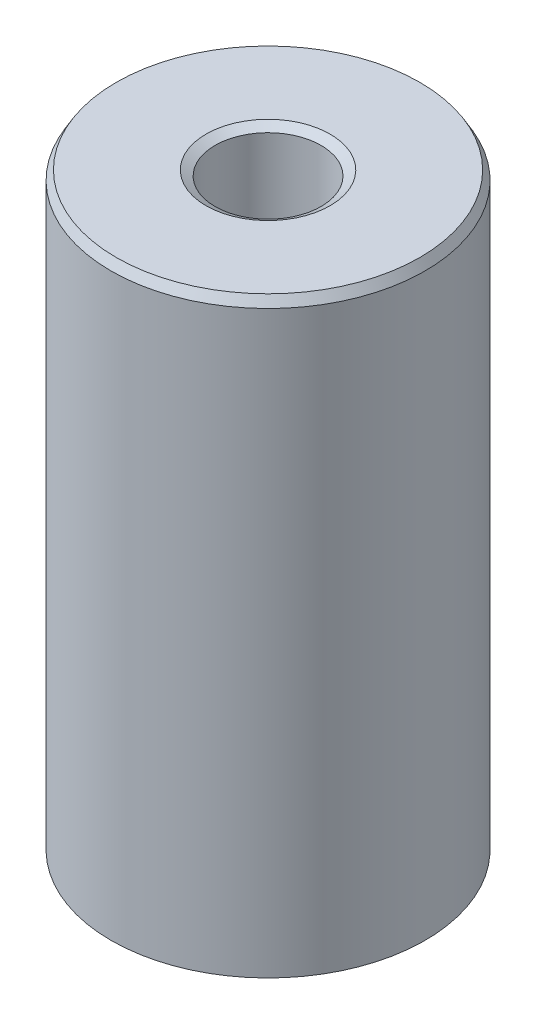
from build123d import *
from OCP.BRepFilletAPI import BRepFilletAPI_MakeChamfer

# Parameters (mm, degrees)
SKETCH1_R           = 10
BOSS_EXTRUDE1_DEPTH = 37.842107728
SKETCH2_R           = 3.376572091
CUT_EXTRUDE1_DEPTH  = 41.398330625
CHAMFER1_SIZE       = 0.575905897
CHAMFER1_SIZE2      = 0.332499425


with BuildPart() as part:
    # Sketch1 → Boss-Extrude1 (new body)
    with BuildSketch(Plane(origin=(0, 0, 0), x_dir=(1, 0, 0), z_dir=(0, 1, 0))):
        Circle(SKETCH1_R)
    extrude(amount=BOSS_EXTRUDE1_DEPTH)

    # Sketch2 → Cut-Extrude1 (cut, through all)
    with BuildSketch(Plane(origin=(0, 0, 0), x_dir=(1, 0, 0), z_dir=(0, 1, 0))):
        Circle(SKETCH2_R)
    extrude(amount=CUT_EXTRUDE1_DEPTH, mode=Mode.SUBTRACT)

    # Chamfer1: one chamfer whose edges measure the first distance from different faces: ONE call of the kernel's chamfer builder (chamfer() names one face for all edges)
    chamfer1_edges_1 = [part.edges().sort_by_distance(p)[0] for p in [
        (-3.376572091, 37.842107728, 0),
    ]]
    chamfer1_side_1 = [part.faces().sort_by_distance(p)[0] for p in [
        (-9.717157288, 37.842107728, 0),
    ]]
    chamfer1_edges_2 = [part.edges().sort_by_distance(p)[0] for p in [
        (-3.376572091, 0, 0),
    ]]
    chamfer1_side_2 = [part.faces().sort_by_distance(p)[0] for p in [
        (-3.376572091, 18.921053864, 0),
    ]]
    chamfer1_edges_3 = [part.edges().sort_by_distance(p)[0] for p in [
        (-10, 0, 0),
    ]]
    chamfer1_side_3 = [part.faces().sort_by_distance(p)[0] for p in [
        (-9.717157288, 0, 0),
    ]]
    chamfer1_edges_4 = [part.edges().sort_by_distance(p)[0] for p in [
        (-10, 37.842107728, 0),
    ]]
    chamfer1_side_4 = [part.faces().sort_by_distance(p)[0] for p in [
        (-10, 18.921053864, 0),
    ]]
    chamfer1 = BRepFilletAPI_MakeChamfer(part.part.solid().wrapped)
    for e in chamfer1_edges_1:
        chamfer1.Add(CHAMFER1_SIZE, CHAMFER1_SIZE2, e.wrapped, chamfer1_side_1[0].wrapped)  # the first distance lies on this face
    for e in chamfer1_edges_2:
        chamfer1.Add(CHAMFER1_SIZE, CHAMFER1_SIZE2, e.wrapped, chamfer1_side_2[0].wrapped)  # the first distance lies on this face
    for e in chamfer1_edges_3:
        chamfer1.Add(CHAMFER1_SIZE, CHAMFER1_SIZE2, e.wrapped, chamfer1_side_3[0].wrapped)  # the first distance lies on this face
    for e in chamfer1_edges_4:
        chamfer1.Add(CHAMFER1_SIZE, CHAMFER1_SIZE2, e.wrapped, chamfer1_side_4[0].wrapped)  # the first distance lies on this face
    add(Compound.cast(chamfer1.Shape()), mode=Mode.REPLACE)


solid = part.part
